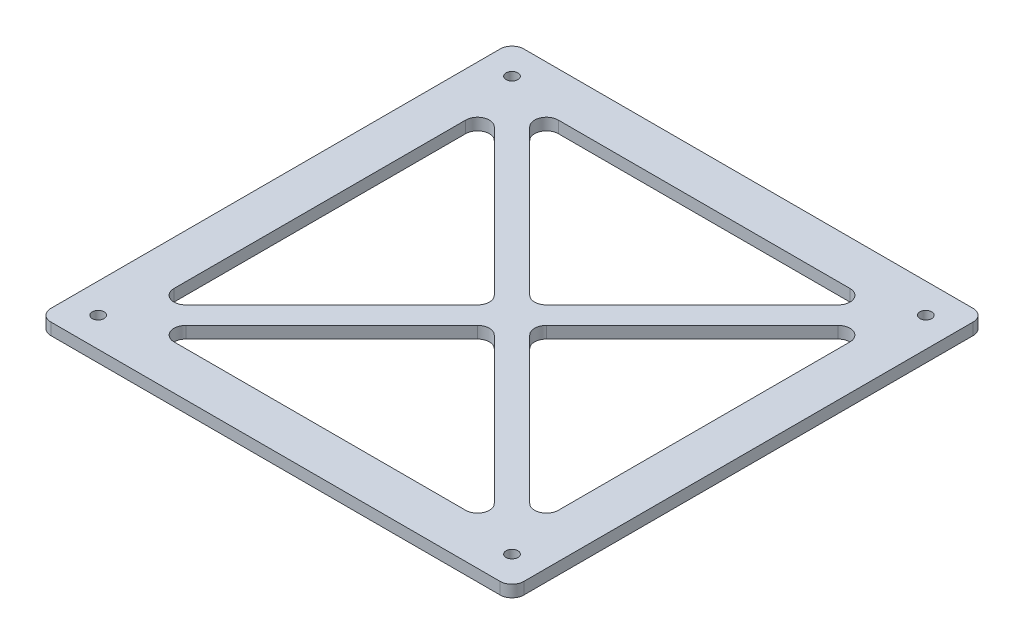
from build123d import *

# Parameters (mm, degrees)
SKETCH_1_W          = 120
SKETCH_1_H          = 120
SKETCH_1_R          = 1.5
EXTRUDE_1_DEPTH     = 3
CUT_EXTRUDE_1_DEPTH = 85.905830189
FILLET_1_R          = 3


with BuildPart() as part:
    # 草圖1 → 填料-伸長1 (new body)
    with BuildSketch(Plane(origin=(0, 0, 0), x_dir=(1, 0, 0), z_dir=(0, 1, 0))):
        Rectangle(SKETCH_1_W, SKETCH_1_H)
        with Locations((-52.5, 52.5)):
            Circle(SKETCH_1_R, mode=Mode.SUBTRACT)
        with Locations((52.5, 52.5)):
            Circle(SKETCH_1_R, mode=Mode.SUBTRACT)
        with Locations((52.5, -52.5)):
            Circle(SKETCH_1_R, mode=Mode.SUBTRACT)
        with Locations((-52.5, -52.5)):
            Circle(SKETCH_1_R, mode=Mode.SUBTRACT)
    extrude(amount=EXTRUDE_1_DEPTH)

    # 草圖3 → 除料-伸長1 (cut, through all)
    with BuildSketch(Plane(origin=(0, 3, 0), x_dir=(1, 0, 0), z_dir=(0, 1, 0))):
        Polygon((-48.75, 44.25), (-4.5, 0), (-48.75, -44.25), align=None)
        Polygon((-44.25, 48.75), (44.25, 48.75), (0, 4.5), align=None)
        Polygon((48.75, 44.25), (48.75, -44.25), (4.5, 0), align=None)
        Polygon((44.25, -48.75), (-44.25, -48.75), (0, -4.5), align=None)
    extrude(amount=-CUT_EXTRUDE_1_DEPTH, mode=Mode.SUBTRACT)

    # 圓角1
    fillet_1_edges = [part.edges().sort_by_distance(p)[0] for p in [
        (44.25, 1.5, 48.75),
        (0, 1.5, 4.5),
        (-44.25, 1.5, 48.75),
        (48.75, 1.5, 44.25),
        (4.5, 1.5, 0),
        (48.75, 1.5, -44.25),
        (0, 1.5, -4.5),
        (-44.25, 1.5, -48.75),
        (44.25, 1.5, -48.75),
        (-48.75, 1.5, 44.25),
        (-48.75, 1.5, -44.25),
        (-4.5, 1.5, 0),
        (-60, 1.5, 60),
        (60, 1.5, 60),
        (-60, 1.5, -60),
        (60, 1.5, -60),
    ]]
    fillet(fillet_1_edges, radius=FILLET_1_R)


solid = part.part
